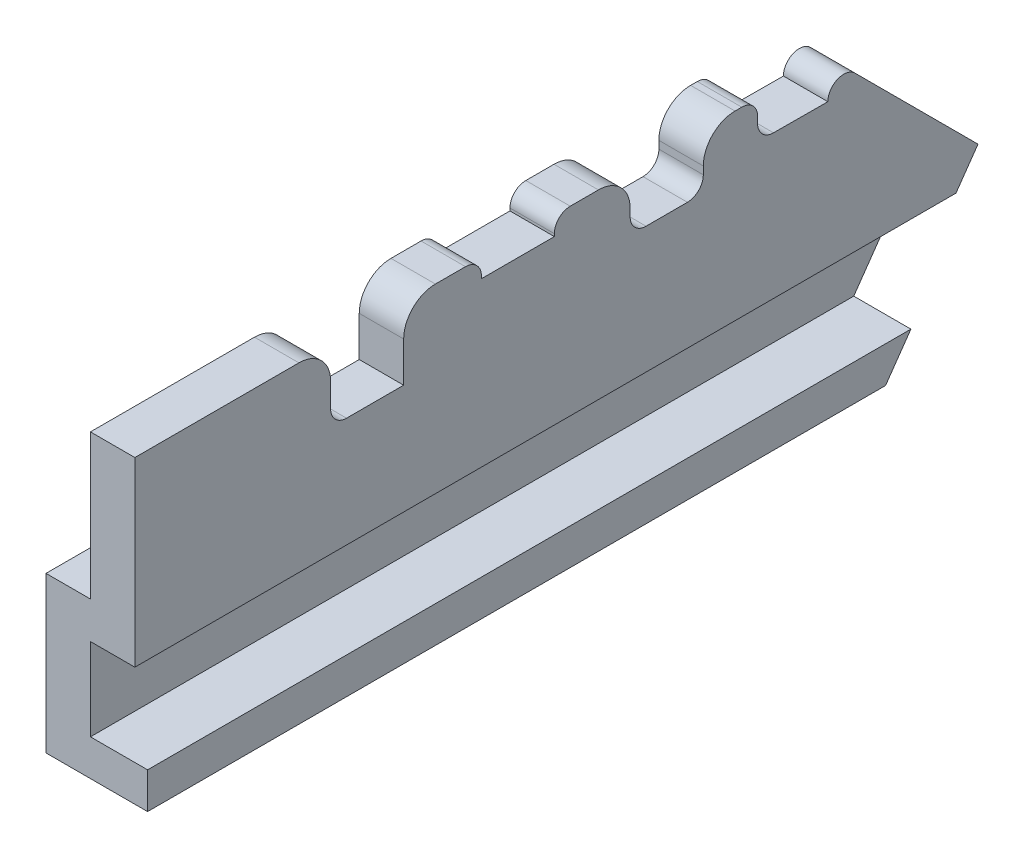
from build123d import *

# Parameters (mm, degrees)
BOSS_EXTRUDE1_DEPTH     = 13.28
CUT_EXTRUDE1_DEPTH      = 14.53406443
CUT_EXTRUDE1_DEPTH_BACK = 14.53406443
CUT_EXTRUDE5_DEPTH      = 0.29
CUT_EXTRUDE6_DEPTH      = 1.13
CUT_EXTRUDE7_DEPTH      = 0.87
CUT_EXTRUDE8_DEPTH      = 0.6
FILLET7_R               = 0.5
FILLET8_R               = 0.5
FILLET13_R              = 0.25
FILLET14_R              = 0.25
FILLET15_R              = 0.5
FILLET16_R              = 0.5
FILLET18_R              = 0.25
FILLET19_R              = 0.25
FILLET20_R              = 0.25
FILLET21_R              = 0.25
FILLET23_R              = 0.25
FILLET25_R              = 0.25


with BuildPart() as part:
    # Sketch1 → Boss-Extrude1 (new body)
    with BuildSketch(Plane.XY):
        Polygon((0, 0), (0, 2.28), (0.7, 2.28), (0.7, -0.58), (0, -0.58), (0, -1.88), (0.9, -1.88), (0.9, -2.45), (-0.7, -2.45), (-0.7, 0), align=None)
    extrude(amount=BOSS_EXTRUDE1_DEPTH)

    # Sketch2 → Cut-Extrude1 (cut, two sides: drawn at the far end of the back side and taken through both)
    with BuildSketch(Plane(origin=(0, 0, 0), x_dir=(0, 0, -1), z_dir=(1, 0, 0)).offset(-CUT_EXTRUDE1_DEPTH_BACK)):
        Polygon((0.8, -2.75), (0.8, -0.085), (0.8, 2.58), (-2.665, 2.58), (0, -0.085), (-1.866053089, -2.75), align=None)
    extrude(amount=CUT_EXTRUDE1_DEPTH + CUT_EXTRUDE1_DEPTH_BACK, mode=Mode.SUBTRACT)

    # 3DSketch1 → Cut-Extrude5 (cut)
    with BuildSketch(Plane(origin=(0.7, 2.28, 7.8225), x_dir=(-0.5199469468957453, 0, -0.8541985556144386), z_dir=(0, 1, 0))):
        Polygon((0, 0), (0.982328339, -0.597938989), (1.346291202, 0), (0.363962863, 0.597938989), align=None)
    extrude(amount=-CUT_EXTRUDE5_DEPTH, mode=Mode.SUBTRACT)

    # 3DSketch1<3> → Cut-Extrude6 (cut)
    with BuildSketch(Plane(origin=(0, 2.28, 10.196397445), x_dir=(0.5199469468957453, 0, -0.8541985556144386), z_dir=(0, 1, 0))):
        Polygon((0, 0), (0.982328339, 0.597938989), (1.346291202, 0), (0.363962863, -0.597938989), align=None)
    extrude(amount=-CUT_EXTRUDE6_DEPTH, mode=Mode.SUBTRACT)

    # 3DSketch1<4> → Cut-Extrude7 (cut)
    with BuildSketch(Plane(origin=(0, 2.28, 5.478611146), x_dir=(0.519345577670118, 0, -0.8545643164528294), z_dir=(0, 1, 0))):
        Polygon((0, 0), (0.984308217, 0.598195022), (1.347850122, 0), (0.363541904, -0.598195022), align=None)
    extrude(amount=-CUT_EXTRUDE7_DEPTH, mode=Mode.SUBTRACT)

    # 3DSketch1<5> → Cut-Extrude8 (cut)
    with BuildSketch(Plane(origin=(0, 2.28, 10.196397445), x_dir=(0.08902885316147792, 0, -0.9960290474201804), z_dir=(0, -1, 0))):
        Polygon((0, 0), (1.145433405, -0.102383181), (1.207753602, 0.594837152), (0.062320197, 0.697220333), align=None)
        Polygon((4.699052194, -0.420019104), (5.846302971, -0.522564728), (5.908623168, 0.174655605), (4.761372391, 0.277201229), align=None)
        Polygon((6.698507562, -0.598738006), (7.800299337, -0.697220333), (7.862619534, 0), (6.760827759, 0.098482327), align=None)
    extrude(amount=CUT_EXTRUDE8_DEPTH, mode=Mode.SUBTRACT)

    # Fillet7
    fillet7_edges = [part.edges().sort_by_distance(p)[0] for p in [
        (0.35, 2.28, 9.046397445),
    ]]
    fillet(fillet7_edges, radius=FILLET7_R)

    # Fillet8
    fillet8_edges = [part.edges().sort_by_distance(p)[0] for p in [
        (0.35, 2.28, 10.196397445),
    ]]
    fillet(fillet8_edges, radius=FILLET8_R)

    # Fillet13
    fillet13_edges = [part.edges().sort_by_distance(p)[0] for p in [
        (0.35, 2.28, 6.6725),
    ]]
    fillet(fillet13_edges, radius=FILLET13_R)

    # Fillet14
    fillet14_edges = [part.edges().sort_by_distance(p)[0] for p in [
        (0.35, 2.28, 7.8225),
    ]]
    fillet(fillet14_edges, radius=FILLET14_R)

    # Fillet15
    fillet15_edges = [part.edges().sort_by_distance(p)[0] for p in [
        (0.35, 2.28, 5.478611146),
    ]]
    fillet(fillet15_edges, radius=FILLET15_R)

    # Fillet16
    fillet16_edges = [part.edges().sort_by_distance(p)[0] for p in [
        (0.35, 2.28, 4.326786528),
    ]]
    fillet(fillet16_edges, radius=FILLET16_R)

    # Fillet18
    fillet18_edges = [part.edges().sort_by_distance(p)[0] for p in [
        (0.35, 2.28, 3.471184381),
    ]]
    fillet(fillet18_edges, radius=FILLET18_R)

    # Fillet19
    # the kernel refuses this fillet: 0.25 mm, written as the material it takes off along each edge
    with BuildSketch(Plane(origin=(2.208795436, 2.28, 2.365), x_dir=(0, -1, 0), z_dir=(-1, 0, 0))) as fillet19_piece_1:
        with BuildLine():
            CenterArc((0.603528489, -0.249975098), FILLET19_R, 90.808696936, 134.191303064)
            Line((0.426751794, -0.426751794), (0.42321626, -0.430287327))
            Line((0.42321626, -0.430287327), (-0.003535534, -0.003535534))
            Line((-0.003535534, -0.003535534), (0, 0.005))
            ThreePointArc((0, 0.005), (0.3, 0.005), (0.59992943, 0.004999502))
            Line((0.59992943, 0.004999502), (0.6, 0))
        make_face()
    extrude(amount=3.717590871, mode=Mode.SUBTRACT)

    # Fillet20
    fillet20_edges = [part.edges().sort_by_distance(p)[0] for p in [
        (0.35, 1.68, 3.471184381),
    ]]
    fillet(fillet20_edges, radius=FILLET20_R)

    # Fillet21
    fillet21_edges = [part.edges().sort_by_distance(p)[0] for p in [
        (0.35, 1.41, 4.326786528),
    ]]
    fillet(fillet21_edges, radius=FILLET21_R)

    # Fillet23
    fillet23_edges = [part.edges().sort_by_distance(p)[0] for p in [
        (0.35, 1.41, 5.478611146),
    ]]
    fillet(fillet23_edges, radius=FILLET23_R)

    # Fillet25
    fillet25_edges = [part.edges().sort_by_distance(p)[0] for p in [
        (0.35, 1.15, 10.196397445),
    ]]
    fillet(fillet25_edges, radius=FILLET25_R)


solid = part.part
